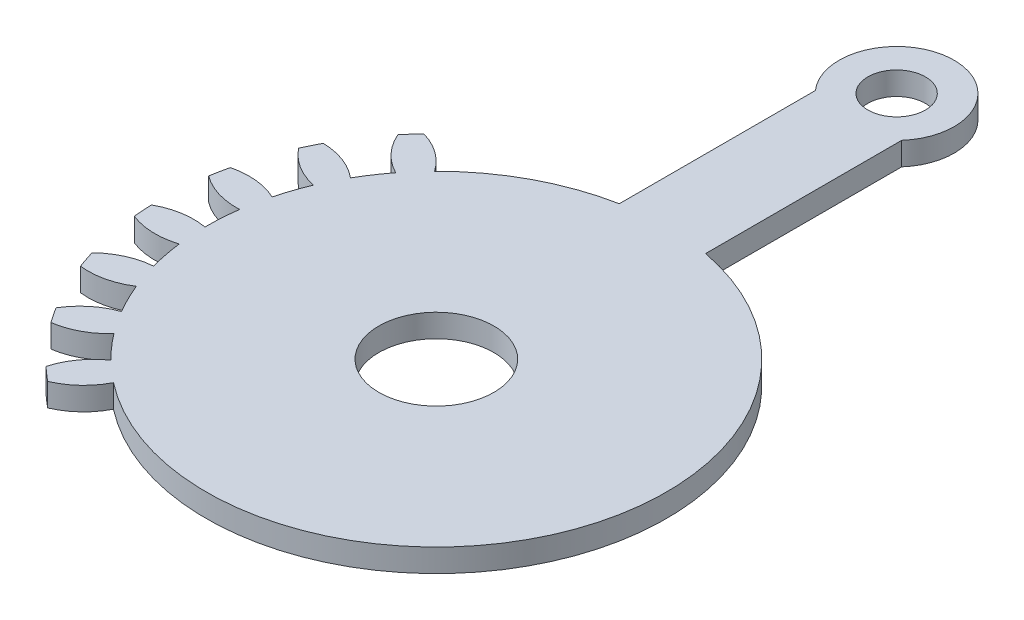
from build123d import *

# Parameters (mm, degrees)
SKETCH1_R           = 25.4
SKETCH1_R_2         = 6.35
BOSS_EXTRUDE1_DEPTH = 2.54
BOSS_EXTRUDE3_DEPTH = 2.54
CIRPATTERN2_DEPTH   = 2.54
SKETCH4_R           = 3.175
BOSS_EXTRUDE4_DEPTH = 2.54


# Read off the part's stored shape, not the designer's step: CirPattern2
with BuildPart() as part:
    # Sketch1 → Boss-Extrude1 (new body)
    with BuildSketch(Plane(origin=(0, 0, 0), x_dir=(1, 0, 0), z_dir=(0, 1, 0))):
        with Locations(Location((0, 0, 0), (0, 0, 270))):
            Circle(SKETCH1_R)
        with Locations(Location((0, 0, 0), (0, 0, 270))):
            Circle(SKETCH1_R_2, mode=Mode.SUBTRACT)
    extrude(amount=BOSS_EXTRUDE1_DEPTH)

    # Sketch3 → Boss-Extrude3 (add)
    with BuildSketch(Plane(origin=(0, 0, 0), x_dir=(1, 0, 0), z_dir=(0, 1, 0))):
        with BuildLine():
            ThreePointArc((-24.569920792, 6.440418643), (-27.081444643, 7.133180463), (-29.679543147, 6.939388921))
            ThreePointArc((-29.679543147, 6.939388921), (-29.894335347, 5.946353015), (-30.075911618, 4.94671005))
            ThreePointArc((-30.075911618, 4.94671005), (-27.7497424, 3.773420758), (-25.164288447, 3.452330656))
            ThreePointArc((-25.164288447, 3.452330656), (-24.911946122, 4.955294179), (-24.569920792, 6.440418643))
        make_face()
    extrude(amount=BOSS_EXTRUDE3_DEPTH)

    # CirPattern2 outline → CirPattern2 (add)
    with BuildSketch(Plane(origin=(0, 0, 0), x_dir=(1, 0, 0), z_dir=(0, 1, 0))):
        with BuildLine():
            ThreePointArc((-23.413307188, 9.847692448), (-22.780567636, 11.234132732), (-22.06581804, 12.580130138))
            ThreePointArc((-22.06581804, 12.580130138), (-24.312463838, 13.899316875), (-26.872191224, 14.384565994))
            ThreePointArc((-26.872191224, 14.384565994), (-27.336681162, 13.480959278), (-27.77079701, 12.562373718))
            ThreePointArc((-27.77079701, 12.562373718), (-25.8275597, 10.827006393), (-23.413307188, 9.847692448))
        make_face()
        with BuildLine():
            ThreePointArc((-20.066747736, 15.571950275), (-19.096731111, 16.747383705), (-18.057966254, 17.862526553))
            ThreePointArc((-18.057966254, 17.862526553), (-19.886628801, 19.718237812), (-22.233543877, 20.849458666))
            ThreePointArc((-22.233543877, 20.849458666), (-22.916077332, 20.096860444), (-23.573148479, 19.321932378))
            ThreePointArc((-23.573148479, 19.321932378), (-22.145271488, 17.142749435), (-20.066747736, 15.571950275))
        make_face()
        with BuildLine():
            ThreePointArc((-15.571950272, -20.066747733), (-16.747383702, -19.096731108), (-17.86252655, -18.057966251))
            ThreePointArc((-17.86252655, -18.057966251), (-19.718237812, -19.886628801), (-20.849458666, -22.233543877))
            ThreePointArc((-20.849458666, -22.233543877), (-20.096860444, -22.916077332), (-19.321932378, -23.573148479))
            ThreePointArc((-19.321932378, -23.573148479), (-17.142749435, -22.145271488), (-15.571950272, -20.066747733))
        make_face()
        with BuildLine():
            ThreePointArc((-20.235005421, -15.352672585), (-21.119328151, -14.111483918), (-21.927621299, -12.819493908))
            ThreePointArc((-21.927621299, -12.819493908), (-24.193393428, -14.105552875), (-25.893495185, -16.079717258))
            ThreePointArc((-25.893495185, -16.079717258), (-25.343193783, -16.933780702), (-24.764733277, -17.769028835))
            ThreePointArc((-24.764733277, -17.769028835), (-22.290242434, -16.953819621), (-20.235005421, -15.352672585))
        make_face()
        with BuildLine():
            ThreePointArc((-23.51907839, -9.592338172), (-24.052025288, -8.164562418), (-24.498384895, -6.70739424))
            ThreePointArc((-24.498384895, -6.70739424), (-27.019809264, -7.363206831), (-29.172932798, -8.830084481))
            ThreePointArc((-29.172932798, -8.830084481), (-28.862430347, -9.797474903), (-28.519858529, -10.753979241))
            ThreePointArc((-28.519858529, -10.753979241), (-25.918692246, -10.606992964), (-23.51907839, -9.592338172))
        make_face()
        with BuildLine():
            ThreePointArc((-30.464283252, -0.978696039), (-30.41473998, -1.993487379), (-30.331402553, -3.006063733))
            ThreePointArc((-30.331402553, -3.006063733), (-27.780826014, -3.537317266), (-25.200365035, -3.178301765))
            ThreePointArc((-25.200365035, -3.178301765), (-25.34561665, -1.661239483), (-25.399624045, -0.138196738))
            ThreePointArc((-25.399624045, -0.138196738), (-28.00486975, -0.11907041), (-30.464283252, -0.978696039))
        make_face()
    extrude(amount=CIRPATTERN2_DEPTH)

    # Sketch4 → Boss-Extrude4 (add)
    with BuildSketch(Plane(origin=(0, 2.54, 0), x_dir=(1, 0, 0), z_dir=(0, 1, 0))):
        with BuildLine():
            Line((-4.7625, 6.35), (4.7625, 6.35))
            Line((4.7625, 6.35), (4.7625, 46.599869794))
            ThreePointArc((4.7625, 46.599869794), (0, 57.15), (-4.7625, 46.599869794))
            Line((-4.7625, 46.599869794), (-4.7625, 6.35))
        make_face()
        with Locations(Location((0, 50.8, 0), (0, 0, 270))):
            Circle(SKETCH4_R, mode=Mode.SUBTRACT)
    extrude(amount=-BOSS_EXTRUDE4_DEPTH)


solid = part.part
